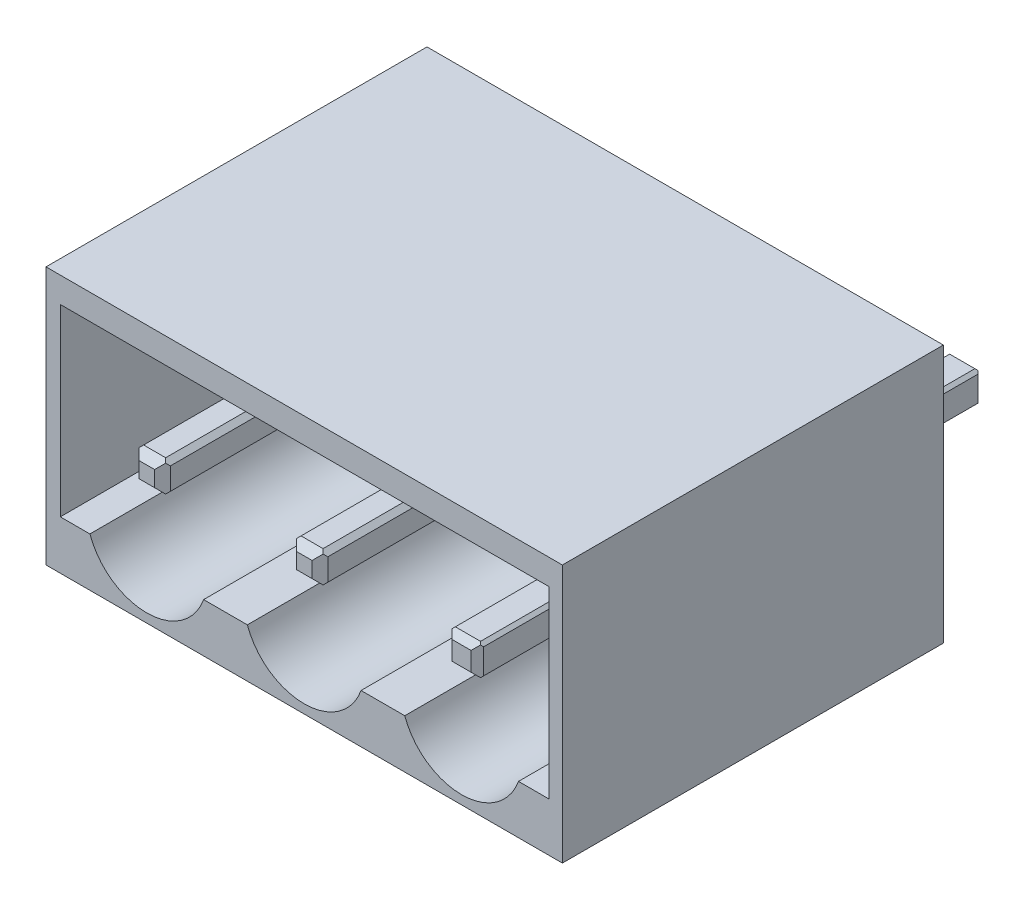
from build123d import *

# Parameters (mm, degrees)
SKETCH_1_W          = 16.4
SKETCH_1_H          = 8.2
EXTRUDE_1_DEPTH     = 12.1
SKETCH_4_R          = 1.25
CUT_EXTRUDE_3_DEPTH = 8
CUT_EXTRUDE_4_DEPTH = 7.8
SKETCH_7_W          = 1
SKETCH_7_H          = 1
EXTRUDE_2_DEPTH     = 8
CHAMFER_1_SIZE      = 0.15
CHAMFER_2_SIZE      = 0.25
SKETCH_8_W          = 1
SKETCH_8_H          = 1
EXTRUDE_3_DEPTH     = 4
CHAMFER_6_SIZE      = 0.1
CHAMFER_7_SIZE      = 0.2
CHAMFER_10_SIZE     = 0.1
CHAMFER_11_SIZE     = 0.2


with BuildPart() as part:
    # Эскиз1 → Бобышка-Вытянуть1 (new body)
    with BuildSketch(Plane.XY):
        Rectangle(SKETCH_1_W, SKETCH_1_H)
    extrude(amount=EXTRUDE_1_DEPTH)

    # Эскиз4 → Вырез-Вытянуть3 (cut)
    with BuildSketch(Plane.XY.offset(12.1)):
        with Locations((-5, 0)):
            Circle(SKETCH_4_R)
        Circle(SKETCH_4_R)
        with Locations((5, 0)):
            Circle(SKETCH_4_R)
    extrude(amount=-CUT_EXTRUDE_3_DEPTH, mode=Mode.SUBTRACT)

    # Эскиз5 → Вырез-Вытянуть4 (cut)
    with BuildSketch(Plane.XY.offset(12.1)):
        with BuildLine():
            Line((-7.745621634, 0), (-7.745621634, 3.292901982))
            Line((-7.745621634, 3.292901982), (2.778509544, 3.292901982))
            Line((2.778509544, 3.292901982), (7.778509544, 3.292901982))
            Line((7.778509544, 3.292901982), (7.778509544, -2.548957219))
            Line((7.778509544, -2.548957219), (6.80582632, -2.548957219))
            ThreePointArc((6.80582632, -2.548957219), (5, -3.818893996), (3.19417368, -2.548957219))
            Line((3.19417368, -2.548957219), (1.80582632, -2.548957219))
            ThreePointArc((1.80582632, -2.548957219), (0, -3.818893996), (-1.80582632, -2.548957219))
            Line((-1.80582632, -2.548957219), (-3.19417368, -2.548957219))
            ThreePointArc((-3.19417368, -2.548957219), (-5, -3.818893996), (-6.80582632, -2.548957219))
            Line((-6.80582632, -2.548957219), (-7.745621634, -2.548957219))
            Line((-7.745621634, -2.548957219), (-7.745621634, 0))
        make_face()
    extrude(amount=-CUT_EXTRUDE_4_DEPTH, mode=Mode.SUBTRACT)

    # Эскиз7 → Бобышка-Вытянуть2 (add)
    with BuildSketch(Plane.XY.offset(4.1)):
        Rectangle(SKETCH_7_W, SKETCH_7_H)
        with Locations((-5, 0)):
            Rectangle(SKETCH_7_W, SKETCH_7_H)
        with Locations((5, 0)):
            Rectangle(SKETCH_7_W, SKETCH_7_H)
    extrude(amount=EXTRUDE_2_DEPTH)

    # Фаска1
    chamfer_1_edges = [part.edges().sort_by_distance(p)[0] for p in [
        (-4.5, -0.5, 8.1),
        (-4.5, 0.5, 8.1),
        (-5.5, 0.5, 8.1),
        (-5.5, -0.5, 8.1),
        (0.5, -0.5, 8.1),
        (0.5, 0.5, 8.1),
        (-0.5, 0.5, 8.1),
        (-0.5, -0.5, 8.1),
    ]]
    chamfer(chamfer_1_edges, length=CHAMFER_1_SIZE)

    # Фаска2
    # the kernel refuses this chamfer: 0.25 mm, written as the material it takes off along each edge
    with BuildSketch(Plane(origin=(-0.5, -0.992920747, 12.1), x_dir=(-0.027495876610586414, 0, -0.9996219169112968), z_dir=(0, 1, 0)), Plane(origin=(-0.992920747, 0.5, 12.1), x_dir=(0, 0.027495876610586414, -0.9996219169112968), z_dir=(1, 0, 0)), Plane(origin=(0.5, 0.992920747, 12.1), x_dir=(0.027495876610586414, 0, -0.9996219169112968), z_dir=(0, -1, 0)), Plane(origin=(0.992920747, -0.5, 12.1), x_dir=(0, -0.027495876610586414, -0.9996219169112968), z_dir=(-1, 0, 0)), Plane(origin=(-4.5, 0.992920747, 12.1), x_dir=(0.02749587661058555, 0, -0.9996219169112968), z_dir=(0, -1, 0)), Plane(origin=(-4.007079253, -0.5, 12.1), x_dir=(0, -0.027495876610586414, -0.9996219169112968), z_dir=(-1, 0, 0)), Plane(origin=(-5.5, -0.992920747, 12.1), x_dir=(-0.02749587661058555, 0, -0.9996219169112968), z_dir=(0, 1, 0)), Plane(origin=(-5.992920747, 0.5, 12.1), x_dir=(0, 0.027495876610586414, -0.9996219169112968), z_dir=(1, 0, 0))) as chamfer_2_piece_1:
        Polygon((CHAMFER_2_SIZE * 0.999621916911, -CHAMFER_2_SIZE * 0.0274958766106), (-CHAMFER_2_SIZE * 0.0274958766106, -CHAMFER_2_SIZE * 0.999621916911), (0, 0), align=None)
    extrude(amount=1.985841494, mode=Mode.SUBTRACT)

    # Эскиз8 → Бобышка-Вытянуть3 (add)
    with BuildSketch(Plane(origin=(0, -4.1, 0), x_dir=(-1, 0, 0), z_dir=(0, 0, 1))):
        with Locations((0, -3.75)):
            Rectangle(SKETCH_8_W, SKETCH_8_H)
        with Locations((5, -3.75)):
            Rectangle(SKETCH_8_W, SKETCH_8_H)
        with Locations((-5, -3.75)):
            Rectangle(SKETCH_8_W, SKETCH_8_H)
    extrude(amount=-EXTRUDE_3_DEPTH)

    # Фаска6
    chamfer_6_edges = [part.edges().sort_by_distance(p)[0] for p in [
        (5.5, -0.5, 8.1),
        (5.5, 0.5, 8.1),
        (4.5, 0.5, 8.1),
        (4.5, -0.5, 8.1),
    ]]
    chamfer(chamfer_6_edges, length=CHAMFER_6_SIZE)

    # Фаска7
    # the kernel refuses this chamfer: 0.2 mm, written as the material it takes off along each edge
    with BuildSketch(Plane(origin=(5.5, 0.914336598, 12.1), x_dir=(0.02749587661058742, 0, -0.9996219169112966), z_dir=(0, -1, 0)), Plane(origin=(5.914336598, -0.5, 12.1), x_dir=(0, -0.02749587661058634, -0.9996219169112966), z_dir=(-1, 0, 0)), Plane(origin=(4.5, -0.914336598, 12.1), x_dir=(-0.02749587661058742, 0, -0.9996219169112966), z_dir=(0, 1, 0)), Plane(origin=(4.085663402, 0.5, 12.1), x_dir=(0, 0.02749587661058634, -0.9996219169112966), z_dir=(1, 0, 0))) as chamfer_7_piece_1:
        Polygon((CHAMFER_7_SIZE * 0.999621916911, -CHAMFER_7_SIZE * 0.0274958766106), (-CHAMFER_7_SIZE * 0.0274958766106, -CHAMFER_7_SIZE * 0.999621916911), (0, 0), align=None)
    extrude(amount=1.828673195, mode=Mode.SUBTRACT)

    # Фаска10
    chamfer_10_edges = [part.edges().sort_by_distance(p)[0] for p in [
        (-4.5, 0.15, -2),
        (-4.5, -0.85, -2),
        (-5.5, -0.85, -2),
        (-5.5, 0.15, -2),
        (0.5, 0.15, -2),
        (0.5, -0.85, -2),
        (-0.5, -0.85, -2),
        (-0.5, 0.15, -2),
        (5.5, 0.15, -2),
        (5.5, -0.85, -2),
        (4.5, -0.85, -2),
        (4.5, 0.15, -2),
    ]]
    chamfer(chamfer_10_edges, length=CHAMFER_10_SIZE)

    # Фаска11
    # the kernel refuses this chamfer: 0.2 mm, written as the material it takes off along each edge
    with BuildSketch(Plane(origin=(-4.5, 0.564336598, -4), x_dir=(0.027495876610587302, 0, 0.9996219169112966), z_dir=(0, -1, 0)), Plane(origin=(-5.914336598, 0.15, -4), x_dir=(0, 0.027495876610586355, 0.9996219169112966), z_dir=(1, 0, 0)), Plane(origin=(-5.5, -1.264336598, -4), x_dir=(-0.027495876610587302, 0, 0.9996219169112966), z_dir=(0, 1, 0)), Plane(origin=(-4.085663402, -0.85, -4), x_dir=(0, -0.027495876610586223, 0.9996219169112966), z_dir=(-1, 0, 0)), Plane(origin=(0.914336598, -0.85, -4), x_dir=(0, -0.027495876610586223, 0.9996219169112966), z_dir=(-1, 0, 0)), Plane(origin=(-0.5, -1.264336598, -4), x_dir=(-0.027495876610586223, 0, 0.9996219169112966), z_dir=(0, 1, 0)), Plane(origin=(-0.914336598, 0.15, -4), x_dir=(0, 0.027495876610586355, 0.9996219169112966), z_dir=(1, 0, 0)), Plane(origin=(0.5, 0.564336598, -4), x_dir=(0.027495876610586223, 0, 0.9996219169112966), z_dir=(0, -1, 0)), Plane(origin=(4.5, -1.264336598, -4), x_dir=(-0.027495876610587302, 0, 0.9996219169112966), z_dir=(0, 1, 0)), Plane(origin=(4.085663402, 0.15, -4), x_dir=(0, 0.027495876610586355, 0.9996219169112966), z_dir=(1, 0, 0)), Plane(origin=(5.5, 0.564336598, -4), x_dir=(0.027495876610587302, 0, 0.9996219169112966), z_dir=(0, -1, 0)), Plane(origin=(5.914336598, -0.85, -4), x_dir=(0, -0.027495876610586223, 0.9996219169112966), z_dir=(-1, 0, 0))) as chamfer_11_piece_1:
        Polygon((CHAMFER_11_SIZE * 0.999621916911, CHAMFER_11_SIZE * 0.0274958766106), (-CHAMFER_11_SIZE * 0.0274958766106, CHAMFER_11_SIZE * 0.999621916911), (0, 0), align=None)
    extrude(amount=1.828673195, mode=Mode.SUBTRACT)


solid = part.part
